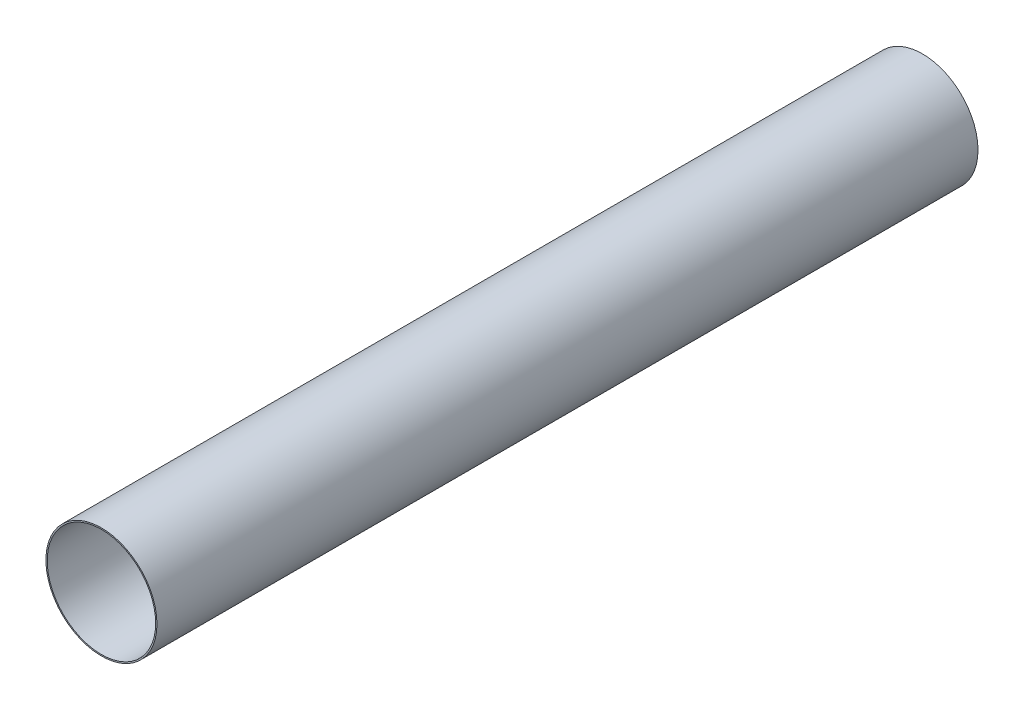
from build123d import *

# Parameters (mm, degrees)
SKETCH1_R           = 84.55
SKETCH1_R_2         = 82.55
BOSS_EXTRUDE1_DEPTH = 625


with BuildPart() as part:
    # Sketch1 → Boss-Extrude1 (new, symmetric)
    with BuildSketch(Plane.XY):
        Circle(SKETCH1_R)
        Circle(SKETCH1_R_2, mode=Mode.SUBTRACT)
    extrude(amount=BOSS_EXTRUDE1_DEPTH, both=True)


solid = part.part
